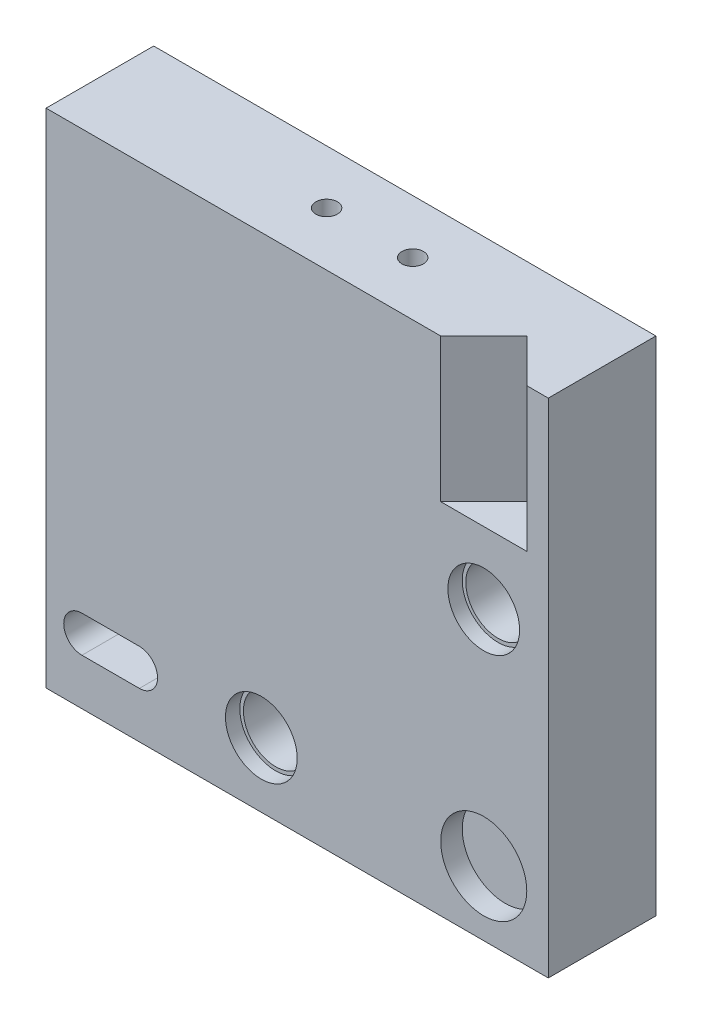
from build123d import *

# Parameters (mm, degrees)
SKETCH1_W           = 35
SKETCH1_H           = 35
BOSS_EXTRUDE1_DEPTH = 7.5
SKETCH2_W           = 24
SKETCH2_H           = 13
CUT_EXTRUDE2_DEPTH  = 5
SKETCH10_R          = 0.75
CUT_EXTRUDE7_DEPTH  = 7
SKETCH5_R           = 2.5
CUT_EXTRUDE11_DEPTH = 1
SKETCH11_R          = 2.25
CUT_EXTRUDE12_DEPTH = 5
CUT_EXTRUDE13_DEPTH = 10
CUT_EXTRUDE14_DEPTH = 10
CUT_EXTRUDE15_DEPTH = 4
BOSS_EXTRUDE2_DEPTH = 10
SKETCH17_R          = 3
CUT_EXTRUDE16_DEPTH = 1.5


with BuildPart() as part:
    # Sketch1 → Boss-Extrude1 (new body)
    with BuildSketch(Plane.XY):
        with Locations((-0.233740073, -3.509910016)):
            Rectangle(SKETCH1_W, SKETCH1_H)
    extrude(amount=BOSS_EXTRUDE1_DEPTH)

    # Sketch2 → Cut-Extrude2 (cut)
    with BuildSketch(Plane(origin=(0, 0, 0), x_dir=(-1, 0, 0), z_dir=(0, 0, -1))):
        with Locations((5.733740073, -3.509910016)):
            Rectangle(SKETCH2_W, SKETCH2_H)
    extrude(amount=-CUT_EXTRUDE2_DEPTH, mode=Mode.SUBTRACT)

    # Sketch10 → Cut-Extrude7 (cut)
    with BuildSketch(Plane(origin=(0, 13.990089984, 0), x_dir=(1, 0, 0), z_dir=(0, 1, 0))):
        with Locations((4.066259927, -3.75)):
            Circle(SKETCH10_R)
        with Locations((-1.933740073, -3.75)):
            Circle(SKETCH10_R)
    extrude(amount=-CUT_EXTRUDE7_DEPTH, mode=Mode.SUBTRACT)

    # Sketch5 → Cut-Extrude11 (cut)
    with BuildSketch(Plane.XY.offset(7.5)):
        with Locations((12.766259927, -1.009910016)):
            Circle(SKETCH5_R)
        with Locations((-2.733740073, -16.509910016)):
            Circle(SKETCH5_R)
    extrude(amount=-CUT_EXTRUDE11_DEPTH, mode=Mode.SUBTRACT)

    # Sketch11 → Cut-Extrude12 (cut)
    with BuildSketch(Plane.XY.offset(6.5)):
        with Locations((-2.733740073, -16.509910016)):
            Circle(SKETCH11_R)
        with Locations((12.766259927, -1.009910016)):
            Circle(SKETCH11_R)
    extrude(amount=-CUT_EXTRUDE12_DEPTH, mode=Mode.SUBTRACT)

    # Sketch13 → Cut-Extrude13 (cut)
    with BuildSketch(Plane.XZ.offset(21.009910016)):
        Polygon((9.766259927, 7.5), (12.766259927, 4.5), (15.766259927, 7.5), align=None)
    extrude(amount=-CUT_EXTRUDE13_DEPTH, mode=Mode.SUBTRACT)

    # Sketch15 → Cut-Extrude14 (cut)
    with BuildSketch(Plane(origin=(0, 13.990089984, 0), x_dir=(1, 0, 0), z_dir=(0, 1, 0))):
        Polygon((9.766259927, -7.5), (12.766259927, -4.5), (15.766259927, -7.5), align=None)
    extrude(amount=-CUT_EXTRUDE14_DEPTH, mode=Mode.SUBTRACT)

    # Sketch4 → Cut-Extrude15 (cut)
    with BuildSketch(Plane.XY.offset(7.5)):
        with BuildLine():
            Line((-11.233740073, -15.239910016), (-15.233740073, -15.239910016))
            ThreePointArc((-15.233740073, -15.239910016), (-16.503740073, -16.509910016), (-15.233740073, -17.779910016))
            Line((-15.233740073, -17.779910016), (-11.233740073, -17.779910016))
            ThreePointArc((-11.233740073, -17.779910016), (-9.963740073, -16.509910016), (-11.233740073, -15.239910016))
        make_face()
    extrude(amount=-CUT_EXTRUDE15_DEPTH, mode=Mode.SUBTRACT)

    # Sketch16 → Boss-Extrude2 (add)
    with BuildSketch(Plane(origin=(0, -11.009910016, 0), x_dir=(-1, 0, 0), z_dir=(0, -1, 0))):
        Polygon((-9.766259927, -7.5), (-15.766259927, -7.5), (-12.766259927, -4.5), align=None)
    extrude(amount=BOSS_EXTRUDE2_DEPTH)

    # Sketch17 → Cut-Extrude16 (cut)
    with BuildSketch(Plane.XY.offset(7.5)):
        with Locations((12.766259927, -16.509910016)):
            Circle(SKETCH17_R)
    extrude(amount=-CUT_EXTRUDE16_DEPTH, mode=Mode.SUBTRACT)


solid = part.part
